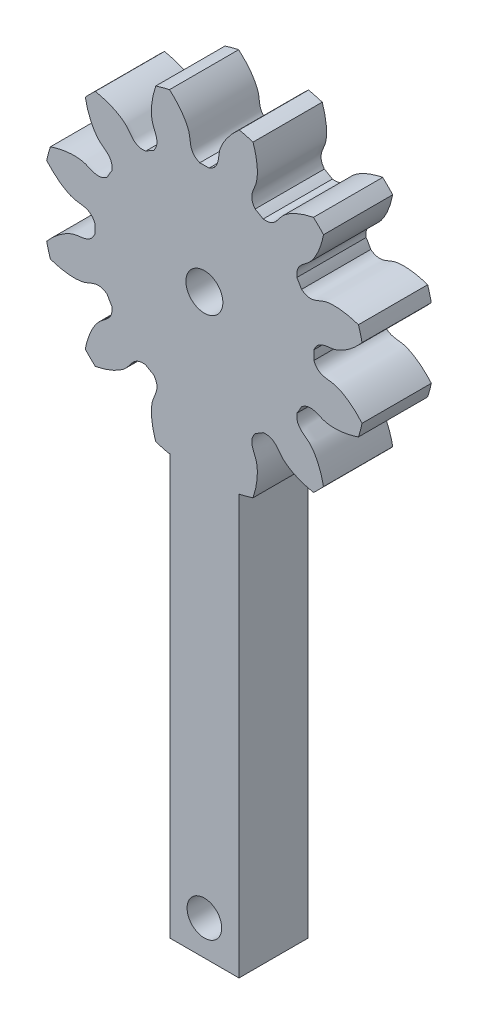
from build123d import *

# Parameters (mm, degrees)
SKETCH_1_R               = 14
EXTRUDE_1_DEPTH          = 30
CUT_EXTRUDE_1_DEPTH      = 36.944401511
PATTERN_CIRCULAR_1_COUNT = 12
CUT_EXTRUDE_START        = -24
CUT_EXTRUDE_2_DEPTH      = 24
EXTRUDE_2_DEPTH          = 6
SKETCH_6_R               = 1.6
CUT_EXTRUDE_3_DEPTH      = 6
SKETCH_7_R               = 1.5
CUT_EXTRUDE_4_DEPTH      = 6


with BuildPart() as part:
    # 草图1 → 凸台-拉伸1 (new body)
    with BuildSketch(Plane.XY):
        Circle(SKETCH_1_R)
    extrude(amount=EXTRUDE_1_DEPTH)

    # 草图2 → 切除-拉伸1 (cut, through all)
    with BuildSketch(Plane.XY):
        with BuildLine():
            ThreePointArc((0.401680225, 9.491504254), (0, 9.5), (-0.401680225, 9.491504254))
            add(Edge.make_bspline(
                [(-0.401680225, 9.491504254), (-1.361577738, 9.898614926), (-1.148746958, 10.689637365), (-1.352304376, 11.378961155), (-1.365247708, 11.419811475), (-1.380454501, 11.46466685), (-1.398085738, 11.513452175), (-1.41830525, 11.566086477), (-1.441273032, 11.622484138), (-1.467147122, 11.682554592), (-1.496082862, 11.746202504), (-1.528232954, 11.813327799), (-1.563747275, 11.883825742), (-1.602772771, 11.957587012), (-1.645453327, 12.034497774), (-1.691929648, 12.114439762), (-1.742339142, 12.197290357), (-1.796815797, 12.282922678), (-1.855490069, 12.371205667), (-1.918488769, 12.462004178), (-1.985934952, 12.555179076), (-2.057947808, 12.650587329), (-2.134642556, 12.748082111), (-2.216130341, 12.847512903), (-2.302518131, 12.948725598), (-2.39390862, 13.051562605), (-2.490400133, 13.155862967), (-2.59208653, 13.261462464), (-2.699057115, 13.368193734), (-2.811396554, 13.475886387), (-2.929184784, 13.584367126), (-3.052496933, 13.693459866), (-3.181403243, 13.802985862), (-3.31596899, 13.912763828), (-3.456254416, 14.02261007), (-3.602314655, 14.132338614), (-3.754199671, 14.241761336), (-3.911954189, 14.350688096), (-4.07561764, 14.458926871), (-4.2452241, 14.566283893), (-4.420802241, 14.672563788), (-4.602375278, 14.77756971), (-4.789960922, 14.881103487), (-4.983571339, 14.98296576), (-5.183213107, 15.082956125), (-5.388887185, 15.18087328), (-5.600588875, 15.276515169), (-5.818307792, 15.369679124), (-6.042027853, 15.460162018), (-6.27172721, 15.547760413), (-6.588759411, 15.661455917), (-6.8311872, 15.740202816), (-6.995210805, 15.78994182)],
                knots=[0, 0, 0, 0, 0.218015236, 0.222043642, 0.226545979, 0.231522246, 0.236972443, 0.24289657, 0.249294627, 0.256166614, 0.263512532, 0.271332379, 0.279626157, 0.288393865, 0.297635503, 0.307351072, 0.31754057, 0.328203999, 0.339341357, 0.350952646, 0.363037866, 0.375597015, 0.388630094, 0.402137104, 0.416118043, 0.430572913, 0.445501713, 0.460904444, 0.476781104, 0.493131694, 0.509956215, 0.527254666, 0.545027047, 0.563273358, 0.581993599, 0.601187771, 0.620855872, 0.640997904, 0.661613866, 0.682703758, 0.704267581, 0.726305333, 0.748817015, 0.771802628, 0.795262171, 0.819195644, 0.843603047, 0.868484381, 0.893839644, 0.919668838, 0.945971962, 1, 1, 1, 1], degree=3))
            ThreePointArc((-6.995210805, 15.78994182), (0, 17.270067658), (6.995210805, 15.78994182))
            add(Edge.make_bspline(
                [(0.401680225, 9.491504254), (1.361577738, 9.898614926), (1.148746958, 10.689637365), (1.352304376, 11.378961155), (1.365247708, 11.419811475), (1.380454501, 11.46466685), (1.398085738, 11.513452175), (1.41830525, 11.566086477), (1.441273032, 11.622484138), (1.467147122, 11.682554592), (1.496082862, 11.746202504), (1.528232954, 11.813327799), (1.563747275, 11.883825742), (1.602772771, 11.957587012), (1.645453327, 12.034497774), (1.691929648, 12.114439762), (1.742339142, 12.197290357), (1.796815797, 12.282922678), (1.855490069, 12.371205667), (1.918488769, 12.462004178), (1.985934952, 12.555179076), (2.057947808, 12.650587329), (2.134642556, 12.748082111), (2.216130341, 12.847512903), (2.302518131, 12.948725598), (2.39390862, 13.051562605), (2.490400133, 13.155862967), (2.59208653, 13.261462464), (2.699057115, 13.368193734), (2.811396554, 13.475886387), (2.929184784, 13.584367126), (3.052496933, 13.693459866), (3.181403243, 13.802985862), (3.31596899, 13.912763828), (3.456254416, 14.02261007), (3.602314655, 14.132338614), (3.754199671, 14.241761336), (3.911954189, 14.350688096), (4.07561764, 14.458926871), (4.2452241, 14.566283893), (4.420802241, 14.672563788), (4.602375278, 14.77756971), (4.789960922, 14.881103487), (4.983571339, 14.98296576), (5.183213107, 15.082956125), (5.388887185, 15.18087328), (5.600588875, 15.276515169), (5.818307792, 15.369679124), (6.042027853, 15.460162018), (6.27172721, 15.547760413), (6.588759411, 15.661455917), (6.8311872, 15.740202816), (6.995210805, 15.78994182)],
                knots=[0, 0, 0, 0, 0.218015236, 0.222043642, 0.226545979, 0.231522246, 0.236972443, 0.24289657, 0.249294627, 0.256166614, 0.263512532, 0.271332379, 0.279626157, 0.288393865, 0.297635503, 0.307351072, 0.31754057, 0.328203999, 0.339341357, 0.350952646, 0.363037866, 0.375597015, 0.388630094, 0.402137104, 0.416118043, 0.430572913, 0.445501713, 0.460904444, 0.476781104, 0.493131694, 0.509956215, 0.527254666, 0.545027047, 0.563273358, 0.581993599, 0.601187771, 0.620855872, 0.640997904, 0.661613866, 0.682703758, 0.704267581, 0.726305333, 0.748817015, 0.771802628, 0.795262171, 0.819195644, 0.843603047, 0.868484381, 0.893839644, 0.919668838, 0.945971962, 1, 1, 1, 1], degree=3))
        make_face()
    cut_extrude_1 = extrude(amount=CUT_EXTRUDE_1_DEPTH, mode=Mode.SUBTRACT)

    # 阵列(圆周)1: 切除-拉伸1 ×12 about axis
    pattern_circular_1_axis = Axis((0, 0, -0.30005125), (0, 0, 1))
    for i in range(1, PATTERN_CIRCULAR_1_COUNT):
        add(cut_extrude_1.rotate(pattern_circular_1_axis, i * 360 / PATTERN_CIRCULAR_1_COUNT), mode=Mode.SUBTRACT)

    # 草图4 → 切除-拉伸2 (cut)
    with BuildSketch(Plane.XY.offset(30).offset(CUT_EXTRUDE_START)):
        with BuildLine():
            ThreePointArc((-4.397886848, 8.420723916), (-4.75, 8.227241336), (-5.093617406, 8.019043691))
            add(Edge.make_bspline(
                [(-5.093617406, 8.019043691), (-6.128468373, 7.891663119), (-6.33966273, 8.683124036), (-6.872053563, 9.189194563), (-6.930941729, 9.241779272), (-7.014505355, 9.310630069), (-7.115111456, 9.387017791), (-7.23347479, 9.469670849), (-7.370233356, 9.557275088), (-7.525948259, 9.64847587), (-7.701100996, 9.741882669), (-7.896091644, 9.836073182), (-8.111237094, 9.929597664), (-8.346769551, 10.020983326), (-8.602835229, 10.108738806), (-8.879493287, 10.191358711), (-9.165466077, 10.264453), (-9.359907912, 10.306399947), (-9.454720416, 10.325127692)],
                knots=[0.476404433, 0.476404433, 0.476404433, 0.476404433, 0.694419669, 0.698448075, 0.707926679, 0.719301003, 0.732571047, 0.747736812, 0.764798298, 0.783755505, 0.804608432, 0.827357079, 0.852001448, 0.878541537, 0.906977346, 0.937308876, 0.969536127, 1, 1, 1, 1], degree=3))
            ThreePointArc((-9.454720416, 10.325127692), (-9.899494937, 9.899494937), (-10.325127692, 9.454720416))
            add(Edge.make_bspline(
                [(-10.325127692, 9.454720416), (-10.296348379, 9.30902008), (-10.241822597, 9.06724705), (-10.150785285, 8.738589846), (-10.065408695, 8.472229927), (-9.975650733, 8.226443701), (-9.883010304, 8.001128416), (-9.788970056, 7.796094703), (-9.694991809, 7.61106784), (-9.602512134, 7.445689138), (-9.512937986, 7.299517571), (-9.427642444, 7.172031609), (-9.359027476, 7.077825756), (-9.296764283, 6.997676569), (-9.241778736, 6.930942283), (-9.189194563, 6.872053563), (-8.683124036, 6.33966273), (-7.891663119, 6.128468373), (-8.019043691, 5.093617406)],
                knots=[0, 0, 0, 0, 0.046814463, 0.078093854, 0.107477524, 0.134965473, 0.160557702, 0.18425421, 0.206054997, 0.225960064, 0.24396941, 0.260083035, 0.27430094, 0.280698997, 0.292073321, 0.301551925, 0.305580331, 0.523595567, 0.523595567, 0.523595567, 0.523595567], degree=3))
            ThreePointArc((-8.019043691, 5.093617406), (-8.227241336, 4.75), (-8.420723916, 4.397886848))
            add(Edge.make_bspline(
                [(-8.420723916, 4.397886848), (-9.253240857, 3.770146552), (-9.831870994, 4.349974635), (-10.545970243, 4.52204915), (-10.623261245, 4.538144761), (-10.730054867, 4.555989488), (-10.855376167, 4.571840145), (-10.99920835, 4.584238126), (-11.161446862, 4.59172634), (-11.341900315, 4.592851082), (-11.540290435, 4.586167374), (-11.756252545, 4.570243427), (-11.989336212, 4.543665279), (-12.239006133, 4.505041355), (-12.504643256, 4.453006992), (-12.785546114, 4.386228899), (-13.06975296, 4.306544015), (-13.259118002, 4.24565022), (-13.350591912, 4.214462671)],
                knots=[0.476404433, 0.476404433, 0.476404433, 0.476404433, 0.694419669, 0.698448075, 0.707926679, 0.719301003, 0.732571047, 0.747736812, 0.764798298, 0.783755505, 0.804608432, 0.827357079, 0.852001448, 0.878541537, 0.906977346, 0.937308876, 0.969536127, 1, 1, 1, 1], degree=3))
            ThreePointArc((-13.350591912, 4.214462671), (-13.522961568, 3.623466631), (-13.669183087, 3.02546422))
            add(Edge.make_bspline(
                [(-13.669183087, 3.02546422), (-13.571409302, 2.913673684), (-13.403302075, 2.731554989), (-13.160132848, 2.492448157), (-12.953014593, 2.304461996), (-12.752388805, 2.136483862), (-12.559502197, 1.987675315), (-12.375544097, 1.857131035), (-12.201643116, 1.743882195), (-12.038864017, 1.646899875), (-11.888204746, 1.565098659), (-11.750593659, 1.497340348), (-11.644068427, 1.45006317), (-11.550072327, 1.411783535), (-11.469086303, 1.381482721), (-11.394102713, 1.35677568), (-10.689637365, 1.148746958), (-9.898614926, 1.361577738), (-9.491504254, 0.401680225)],
                knots=[0, 0, 0, 0, 0.046814463, 0.078093854, 0.107477524, 0.134965473, 0.160557702, 0.18425421, 0.206054997, 0.225960064, 0.24396941, 0.260083035, 0.27430094, 0.280698997, 0.292073321, 0.301551925, 0.305580331, 0.523595567, 0.523595567, 0.523595567, 0.523595567], degree=3))
            ThreePointArc((-9.491504254, 0.401680225), (-9.5, 0), (-9.491504254, -0.401680225))
            add(Edge.make_bspline(
                [(-9.491504254, -0.401680225), (-9.898614926, -1.361577738), (-10.689637365, -1.148746958), (-11.394102713, -1.35677568), (-11.46908649, -1.381481974), (-11.570494842, -1.419424798), (-11.686951601, -1.468358376), (-11.817712915, -1.529537501), (-11.961959695, -1.604171774), (-12.118799341, -1.693424445), (-12.287268371, -1.798407765), (-12.466335071, -1.920179363), (-12.654902373, -2.059738548), (-12.851810906, -2.218022808), (-13.055842221, -2.39590445), (-13.265722186, -2.594187404), (-13.472010092, -2.805299961), (-13.605558131, -2.952718055), (-13.669183087, -3.02546422)],
                knots=[0.476404433, 0.476404433, 0.476404433, 0.476404433, 0.694419669, 0.698448075, 0.707926679, 0.719301003, 0.732571047, 0.747736812, 0.764798298, 0.783755505, 0.804608432, 0.827357079, 0.852001448, 0.878541537, 0.906977346, 0.937308876, 0.969536127, 1, 1, 1, 1], degree=3))
            ThreePointArc((-13.669183087, -3.02546422), (-13.522961568, -3.623466631), (-13.350591912, -4.214462671))
            add(Edge.make_bspline(
                [(-13.350591912, -4.214462671), (-13.210022063, -4.262389222), (-12.973377586, -4.336055025), (-12.643233442, -4.421543002), (-12.369870692, -4.480784666), (-12.112134595, -4.525945103), (-11.870685619, -4.558373781), (-11.646101091, -4.579449393), (-11.438874004, -4.590575276), (-11.249412009, -4.593174879), (-11.078036645, -4.588687175), (-10.924982792, -4.57856205), (-10.809090647, -4.566242671), (-10.708547818, -4.552395758), (-10.623261457, -4.53814402), (-10.545970243, -4.52204915), (-9.831870994, -4.349974635), (-9.253240857, -3.770146552), (-8.420723916, -4.397886848)],
                knots=[0, 0, 0, 0, 0.046814463, 0.078093854, 0.107477524, 0.134965473, 0.160557702, 0.18425421, 0.206054997, 0.225960064, 0.24396941, 0.260083035, 0.27430094, 0.280698997, 0.292073321, 0.301551925, 0.305580331, 0.523595567, 0.523595567, 0.523595567, 0.523595567], degree=3))
            ThreePointArc((-8.420723916, -4.397886848), (-8.227241336, -4.75), (-8.019043691, -5.093617406))
            add(Edge.make_bspline(
                [(-8.019043691, -5.093617406), (-7.891663119, -6.128468373), (-8.683124036, -6.33966273), (-9.189194563, -6.872053563), (-9.241779272, -6.930941729), (-9.310630069, -7.014505355), (-9.387017791, -7.115111456), (-9.469670849, -7.23347479), (-9.557275088, -7.370233356), (-9.64847587, -7.525948259), (-9.741882669, -7.701100996), (-9.836073182, -7.896091644), (-9.929597664, -8.111237094), (-10.020983326, -8.346769551), (-10.108738806, -8.602835229), (-10.191358711, -8.879493287), (-10.264453, -9.165466077), (-10.306399947, -9.359907912), (-10.325127692, -9.454720416)],
                knots=[0.476404433, 0.476404433, 0.476404433, 0.476404433, 0.694419669, 0.698448075, 0.707926679, 0.719301003, 0.732571047, 0.747736812, 0.764798298, 0.783755505, 0.804608432, 0.827357079, 0.852001448, 0.878541537, 0.906977346, 0.937308876, 0.969536127, 1, 1, 1, 1], degree=3))
            ThreePointArc((-10.325127692, -9.454720416), (-9.899494937, -9.899494937), (-9.454720416, -10.325127692))
            add(Edge.make_bspline(
                [(-9.454720416, -10.325127692), (-9.30902008, -10.296348379), (-9.06724705, -10.241822597), (-8.738589846, -10.150785285), (-8.472229927, -10.065408695), (-8.226443701, -9.975650733), (-8.001128416, -9.883010304), (-7.796094703, -9.788970056), (-7.61106784, -9.694991809), (-7.445689138, -9.602512134), (-7.299517571, -9.512937986), (-7.172031609, -9.427642444), (-7.077825756, -9.359027476), (-6.997676569, -9.296764283), (-6.930942283, -9.241778736), (-6.872053563, -9.189194563), (-6.33966273, -8.683124036), (-6.128468373, -7.891663119), (-5.093617406, -8.019043691)],
                knots=[0, 0, 0, 0, 0.046814463, 0.078093854, 0.107477524, 0.134965473, 0.160557702, 0.18425421, 0.206054997, 0.225960064, 0.24396941, 0.260083035, 0.27430094, 0.280698997, 0.292073321, 0.301551925, 0.305580331, 0.523595567, 0.523595567, 0.523595567, 0.523595567], degree=3))
            ThreePointArc((-5.093617406, -8.019043691), (-4.75, -8.227241336), (-4.397886848, -8.420723916))
            add(Edge.make_bspline(
                [(-4.397886848, -8.420723916), (-3.770146552, -9.253240857), (-4.349974635, -9.831870994), (-4.52204915, -10.545970243), (-4.538144761, -10.623261245), (-4.555989488, -10.730054867), (-4.571840145, -10.855376167), (-4.584238126, -10.99920835), (-4.59172634, -11.161446862), (-4.592851082, -11.341900315), (-4.586167374, -11.540290435), (-4.570243427, -11.756252545), (-4.543665279, -11.989336212), (-4.505041355, -12.239006133), (-4.453006992, -12.504643256), (-4.386228899, -12.785546114), (-4.306544015, -13.06975296), (-4.24565022, -13.259118002), (-4.214462671, -13.350591912)],
                knots=[0.476404433, 0.476404433, 0.476404433, 0.476404433, 0.694419669, 0.698448075, 0.707926679, 0.719301003, 0.732571047, 0.747736812, 0.764798298, 0.783755505, 0.804608432, 0.827357079, 0.852001448, 0.878541537, 0.906977346, 0.937308876, 0.969536127, 1, 1, 1, 1], degree=3))
            ThreePointArc((-4.214462671, -13.350591912), (-3.623466631, -13.522961568), (-3.02546422, -13.669183087))
            add(Edge.make_bspline(
                [(-3.02546422, -13.669183087), (-2.913673684, -13.571409302), (-2.731554989, -13.403302075), (-2.492448157, -13.160132848), (-2.304461996, -12.953014593), (-2.136483862, -12.752388805), (-1.987675315, -12.559502197), (-1.857131035, -12.375544097), (-1.743882195, -12.201643116), (-1.646899875, -12.038864017), (-1.565098659, -11.888204746), (-1.497340348, -11.750593659), (-1.45006317, -11.644068427), (-1.411783535, -11.550072327), (-1.381482721, -11.469086303), (-1.35677568, -11.394102713), (-1.148746958, -10.689637365), (-1.361577738, -9.898614926), (-0.401680225, -9.491504254)],
                knots=[0, 0, 0, 0, 0.046814463, 0.078093854, 0.107477524, 0.134965473, 0.160557702, 0.18425421, 0.206054997, 0.225960064, 0.24396941, 0.260083035, 0.27430094, 0.280698997, 0.292073321, 0.301551925, 0.305580331, 0.523595567, 0.523595567, 0.523595567, 0.523595567], degree=3))
            ThreePointArc((-0.401680225, -9.491504254), (0, -9.5), (0.401680225, -9.491504254))
            add(Edge.make_bspline(
                [(0.401680225, -9.491504254), (1.361577738, -9.898614926), (1.148746958, -10.689637365), (1.35677568, -11.394102713), (1.381481974, -11.46908649), (1.419424798, -11.570494842), (1.468358376, -11.686951601), (1.529537501, -11.817712915), (1.604171774, -11.961959695), (1.693424445, -12.118799341), (1.798407765, -12.287268371), (1.920179363, -12.466335071), (2.059738548, -12.654902373), (2.218022808, -12.851810906), (2.39590445, -13.055842221), (2.594187404, -13.265722186), (2.805299961, -13.472010092), (2.952718055, -13.605558131), (3.02546422, -13.669183087)],
                knots=[0.476404433, 0.476404433, 0.476404433, 0.476404433, 0.694419669, 0.698448075, 0.707926679, 0.719301003, 0.732571047, 0.747736812, 0.764798298, 0.783755505, 0.804608432, 0.827357079, 0.852001448, 0.878541537, 0.906977346, 0.937308876, 0.969536127, 1, 1, 1, 1], degree=3))
            ThreePointArc((3.02546422, -13.669183087), (3.623466631, -13.522961568), (4.214462671, -13.350591912))
            add(Edge.make_bspline(
                [(4.214462671, -13.350591912), (4.262389222, -13.210022063), (4.336055025, -12.973377586), (4.421543002, -12.643233442), (4.480784666, -12.369870692), (4.525945103, -12.112134595), (4.558373781, -11.870685619), (4.579449393, -11.646101091), (4.590575276, -11.438874004), (4.593174879, -11.249412009), (4.588687175, -11.078036645), (4.57856205, -10.924982792), (4.566242671, -10.809090647), (4.552395758, -10.708547818), (4.53814402, -10.623261457), (4.52204915, -10.545970243), (4.349974635, -9.831870994), (3.770146552, -9.253240857), (4.397886848, -8.420723916)],
                knots=[0, 0, 0, 0, 0.046814463, 0.078093854, 0.107477524, 0.134965473, 0.160557702, 0.18425421, 0.206054997, 0.225960064, 0.24396941, 0.260083035, 0.27430094, 0.280698997, 0.292073321, 0.301551925, 0.305580331, 0.523595567, 0.523595567, 0.523595567, 0.523595567], degree=3))
            ThreePointArc((4.397886848, -8.420723916), (4.75, -8.227241336), (5.093617406, -8.019043691))
            add(Edge.make_bspline(
                [(5.093617406, -8.019043691), (6.128468373, -7.891663119), (6.33966273, -8.683124036), (6.872053563, -9.189194563), (6.930941729, -9.241779272), (7.014505355, -9.310630069), (7.115111456, -9.387017791), (7.23347479, -9.469670849), (7.370233356, -9.557275088), (7.525948259, -9.64847587), (7.701100996, -9.741882669), (7.896091644, -9.836073182), (8.111237094, -9.929597664), (8.346769551, -10.020983326), (8.602835229, -10.108738806), (8.879493287, -10.191358711), (9.165466077, -10.264453), (9.359907912, -10.306399947), (9.454720416, -10.325127692)],
                knots=[0.476404433, 0.476404433, 0.476404433, 0.476404433, 0.694419669, 0.698448075, 0.707926679, 0.719301003, 0.732571047, 0.747736812, 0.764798298, 0.783755505, 0.804608432, 0.827357079, 0.852001448, 0.878541537, 0.906977346, 0.937308876, 0.969536127, 1, 1, 1, 1], degree=3))
            ThreePointArc((9.454720416, -10.325127692), (9.899494937, -9.899494937), (10.325127692, -9.454720416))
            add(Edge.make_bspline(
                [(10.325127692, -9.454720416), (10.296348379, -9.30902008), (10.241822597, -9.06724705), (10.150785285, -8.738589846), (10.065408695, -8.472229927), (9.975650733, -8.226443701), (9.883010304, -8.001128416), (9.788970056, -7.796094703), (9.694991809, -7.61106784), (9.602512134, -7.445689138), (9.512937986, -7.299517571), (9.427642444, -7.172031609), (9.359027476, -7.077825756), (9.296764283, -6.997676569), (9.241778736, -6.930942283), (9.189194563, -6.872053563), (8.683124036, -6.33966273), (7.891663119, -6.128468373), (8.019043691, -5.093617406)],
                knots=[0, 0, 0, 0, 0.046814463, 0.078093854, 0.107477524, 0.134965473, 0.160557702, 0.18425421, 0.206054997, 0.225960064, 0.24396941, 0.260083035, 0.27430094, 0.280698997, 0.292073321, 0.301551925, 0.305580331, 0.523595567, 0.523595567, 0.523595567, 0.523595567], degree=3))
            ThreePointArc((8.019043691, -5.093617406), (8.227241336, -4.75), (8.420723916, -4.397886848))
            add(Edge.make_bspline(
                [(8.420723916, -4.397886848), (9.253240857, -3.770146552), (9.831870994, -4.349974635), (10.545970243, -4.52204915), (10.623261245, -4.538144761), (10.730054867, -4.555989488), (10.855376167, -4.571840145), (10.99920835, -4.584238126), (11.161446862, -4.59172634), (11.341900315, -4.592851082), (11.540290435, -4.586167374), (11.756252545, -4.570243427), (11.989336212, -4.543665279), (12.239006133, -4.505041355), (12.504643256, -4.453006992), (12.785546114, -4.386228899), (13.06975296, -4.306544015), (13.259118002, -4.24565022), (13.350591912, -4.214462671)],
                knots=[0.476404433, 0.476404433, 0.476404433, 0.476404433, 0.694419669, 0.698448075, 0.707926679, 0.719301003, 0.732571047, 0.747736812, 0.764798298, 0.783755505, 0.804608432, 0.827357079, 0.852001448, 0.878541537, 0.906977346, 0.937308876, 0.969536127, 1, 1, 1, 1], degree=3))
            ThreePointArc((13.350591912, -4.214462671), (13.522961568, -3.623466631), (13.669183087, -3.02546422))
            add(Edge.make_bspline(
                [(13.669183087, -3.02546422), (13.571409302, -2.913673684), (13.403302075, -2.731554989), (13.160132848, -2.492448157), (12.953014593, -2.304461996), (12.752388805, -2.136483862), (12.559502197, -1.987675315), (12.375544097, -1.857131035), (12.201643116, -1.743882195), (12.038864017, -1.646899875), (11.888204746, -1.565098659), (11.750593659, -1.497340348), (11.644068427, -1.45006317), (11.550072327, -1.411783535), (11.469086303, -1.381482721), (11.394102713, -1.35677568), (10.689637365, -1.148746958), (9.898614926, -1.361577738), (9.491504254, -0.401680225)],
                knots=[0, 0, 0, 0, 0.046814463, 0.078093854, 0.107477524, 0.134965473, 0.160557702, 0.18425421, 0.206054997, 0.225960064, 0.24396941, 0.260083035, 0.27430094, 0.280698997, 0.292073321, 0.301551925, 0.305580331, 0.523595567, 0.523595567, 0.523595567, 0.523595567], degree=3))
            ThreePointArc((9.491504254, -0.401680225), (9.5, 0), (9.491504254, 0.401680225))
            add(Edge.make_bspline(
                [(9.491504254, 0.401680225), (9.898614926, 1.361577738), (10.689637365, 1.148746958), (11.394102713, 1.35677568), (11.46908649, 1.381481974), (11.570494842, 1.419424798), (11.686951601, 1.468358376), (11.817712915, 1.529537501), (11.961959695, 1.604171774), (12.118799341, 1.693424445), (12.287268371, 1.798407765), (12.466335071, 1.920179363), (12.654902373, 2.059738548), (12.851810906, 2.218022808), (13.055842221, 2.39590445), (13.265722186, 2.594187404), (13.472010092, 2.805299961), (13.605558131, 2.952718055), (13.669183087, 3.02546422)],
                knots=[0.476404433, 0.476404433, 0.476404433, 0.476404433, 0.694419669, 0.698448075, 0.707926679, 0.719301003, 0.732571047, 0.747736812, 0.764798298, 0.783755505, 0.804608432, 0.827357079, 0.852001448, 0.878541537, 0.906977346, 0.937308876, 0.969536127, 1, 1, 1, 1], degree=3))
            ThreePointArc((13.669183087, 3.02546422), (13.522961568, 3.623466631), (13.350591912, 4.214462671))
            add(Edge.make_bspline(
                [(13.350591912, 4.214462671), (13.210022063, 4.262389222), (12.973377586, 4.336055025), (12.643233442, 4.421543002), (12.369870692, 4.480784666), (12.112134595, 4.525945103), (11.870685619, 4.558373781), (11.646101091, 4.579449393), (11.438874004, 4.590575276), (11.249412009, 4.593174879), (11.078036645, 4.588687175), (10.924982792, 4.57856205), (10.809090647, 4.566242671), (10.708547818, 4.552395758), (10.623261457, 4.53814402), (10.545970243, 4.52204915), (9.831870994, 4.349974635), (9.253240857, 3.770146552), (8.420723916, 4.397886848)],
                knots=[0, 0, 0, 0, 0.046814463, 0.078093854, 0.107477524, 0.134965473, 0.160557702, 0.18425421, 0.206054997, 0.225960064, 0.24396941, 0.260083035, 0.27430094, 0.280698997, 0.292073321, 0.301551925, 0.305580331, 0.523595567, 0.523595567, 0.523595567, 0.523595567], degree=3))
            ThreePointArc((8.420723916, 4.397886848), (8.227241336, 4.75), (8.019043691, 5.093617406))
            add(Edge.make_bspline(
                [(8.019043691, 5.093617406), (7.891663119, 6.128468373), (8.683124036, 6.33966273), (9.189194563, 6.872053563), (9.241779272, 6.930941729), (9.310630069, 7.014505355), (9.387017791, 7.115111456), (9.469670849, 7.23347479), (9.557275088, 7.370233356), (9.64847587, 7.525948259), (9.741882669, 7.701100996), (9.836073182, 7.896091644), (9.929597664, 8.111237094), (10.020983326, 8.346769551), (10.108738806, 8.602835229), (10.191358711, 8.879493287), (10.264453, 9.165466077), (10.306399947, 9.359907912), (10.325127692, 9.454720416)],
                knots=[0.476404433, 0.476404433, 0.476404433, 0.476404433, 0.694419669, 0.698448075, 0.707926679, 0.719301003, 0.732571047, 0.747736812, 0.764798298, 0.783755505, 0.804608432, 0.827357079, 0.852001448, 0.878541537, 0.906977346, 0.937308876, 0.969536127, 1, 1, 1, 1], degree=3))
            ThreePointArc((10.325127692, 9.454720416), (9.899494937, 9.899494937), (9.454720416, 10.325127692))
            add(Edge.make_bspline(
                [(9.454720416, 10.325127692), (9.30902008, 10.296348379), (9.06724705, 10.241822597), (8.738589846, 10.150785285), (8.472229927, 10.065408695), (8.226443701, 9.975650733), (8.001128416, 9.883010304), (7.796094703, 9.788970056), (7.61106784, 9.694991809), (7.445689138, 9.602512134), (7.299517571, 9.512937986), (7.172031609, 9.427642444), (7.077825756, 9.359027476), (6.997676569, 9.296764283), (6.930942283, 9.241778736), (6.872053563, 9.189194563), (6.33966273, 8.683124036), (6.128468373, 7.891663119), (5.093617406, 8.019043691)],
                knots=[0, 0, 0, 0, 0.046814463, 0.078093854, 0.107477524, 0.134965473, 0.160557702, 0.18425421, 0.206054997, 0.225960064, 0.24396941, 0.260083035, 0.27430094, 0.280698997, 0.292073321, 0.301551925, 0.305580331, 0.523595567, 0.523595567, 0.523595567, 0.523595567], degree=3))
            ThreePointArc((5.093617406, 8.019043691), (4.75, 8.227241336), (4.397886848, 8.420723916))
            add(Edge.make_bspline(
                [(4.397886848, 8.420723916), (3.770146552, 9.253240857), (4.349974635, 9.831870994), (4.52204915, 10.545970243), (4.538144761, 10.623261245), (4.555989488, 10.730054867), (4.571840145, 10.855376167), (4.584238126, 10.99920835), (4.59172634, 11.161446862), (4.592851082, 11.341900315), (4.586167374, 11.540290435), (4.570243427, 11.756252545), (4.543665279, 11.989336212), (4.505041355, 12.239006133), (4.453006992, 12.504643256), (4.386228899, 12.785546114), (4.306544015, 13.06975296), (4.24565022, 13.259118002), (4.214462671, 13.350591912)],
                knots=[0.476404433, 0.476404433, 0.476404433, 0.476404433, 0.694419669, 0.698448075, 0.707926679, 0.719301003, 0.732571047, 0.747736812, 0.764798298, 0.783755505, 0.804608432, 0.827357079, 0.852001448, 0.878541537, 0.906977346, 0.937308876, 0.969536127, 1, 1, 1, 1], degree=3))
            ThreePointArc((4.214462671, 13.350591912), (3.623466631, 13.522961568), (3.02546422, 13.669183087))
            add(Edge.make_bspline(
                [(3.02546422, 13.669183087), (2.913673684, 13.571409302), (2.731554989, 13.403302075), (2.492448157, 13.160132848), (2.304461996, 12.953014593), (2.136483862, 12.752388805), (1.987675315, 12.559502197), (1.857131035, 12.375544097), (1.743882195, 12.201643116), (1.646899875, 12.038864017), (1.565098659, 11.888204746), (1.497340348, 11.750593659), (1.45006317, 11.644068427), (1.411783535, 11.550072327), (1.381482721, 11.469086303), (1.35677568, 11.394102713), (1.148746958, 10.689637365), (1.361577738, 9.898614926), (0.401680225, 9.491504254)],
                knots=[0, 0, 0, 0, 0.046814463, 0.078093854, 0.107477524, 0.134965473, 0.160557702, 0.18425421, 0.206054997, 0.225960064, 0.24396941, 0.260083035, 0.27430094, 0.280698997, 0.292073321, 0.301551925, 0.305580331, 0.523595567, 0.523595567, 0.523595567, 0.523595567], degree=3))
            ThreePointArc((0.401680225, 9.491504254), (0, 9.5), (-0.401680225, 9.491504254))
            add(Edge.make_bspline(
                [(-0.401680225, 9.491504254), (-1.361577738, 9.898614926), (-1.148746958, 10.689637365), (-1.35677568, 11.394102713), (-1.381481974, 11.46908649), (-1.419424798, 11.570494842), (-1.468358376, 11.686951601), (-1.529537501, 11.817712915), (-1.604171774, 11.961959695), (-1.693424445, 12.118799341), (-1.798407765, 12.287268371), (-1.920179363, 12.466335071), (-2.059738548, 12.654902373), (-2.218022808, 12.851810906), (-2.39590445, 13.055842221), (-2.594187404, 13.265722186), (-2.805299961, 13.472010092), (-2.952718055, 13.605558131), (-3.02546422, 13.669183087)],
                knots=[0.476404433, 0.476404433, 0.476404433, 0.476404433, 0.694419669, 0.698448075, 0.707926679, 0.719301003, 0.732571047, 0.747736812, 0.764798298, 0.783755505, 0.804608432, 0.827357079, 0.852001448, 0.878541537, 0.906977346, 0.937308876, 0.969536127, 1, 1, 1, 1], degree=3))
            ThreePointArc((-3.02546422, 13.669183087), (-3.623466631, 13.522961568), (-4.214462671, 13.350591912))
            add(Edge.make_bspline(
                [(-4.214462671, 13.350591912), (-4.262389222, 13.210022063), (-4.336055025, 12.973377586), (-4.421543002, 12.643233442), (-4.480784666, 12.369870692), (-4.525945103, 12.112134595), (-4.558373781, 11.870685619), (-4.579449393, 11.646101091), (-4.590575276, 11.438874004), (-4.593174879, 11.249412009), (-4.588687175, 11.078036645), (-4.57856205, 10.924982792), (-4.566242671, 10.809090647), (-4.552395758, 10.708547818), (-4.53814402, 10.623261457), (-4.52204915, 10.545970243), (-4.349974635, 9.831870994), (-3.770146552, 9.253240857), (-4.397886848, 8.420723916)],
                knots=[0, 0, 0, 0, 0.046814463, 0.078093854, 0.107477524, 0.134965473, 0.160557702, 0.18425421, 0.206054997, 0.225960064, 0.24396941, 0.260083035, 0.27430094, 0.280698997, 0.292073321, 0.301551925, 0.305580331, 0.523595567, 0.523595567, 0.523595567, 0.523595567], degree=3))
        make_face()
    extrude(amount=CUT_EXTRUDE_2_DEPTH, mode=Mode.SUBTRACT)

    # 草图5 → 凸台-拉伸2 (add)
    with BuildSketch(Plane.XY.offset(6)):
        Polygon((0, -5), (-3, -5), (-3, -50), (3, -50), (3, -5), align=None)
    extrude(amount=-EXTRUDE_2_DEPTH)

    # 草图6 → 切除-拉伸3 (cut)
    with BuildSketch(Plane.XY.offset(6)):
        Circle(SKETCH_6_R)
    extrude(amount=-CUT_EXTRUDE_3_DEPTH, mode=Mode.SUBTRACT)

    # 草图7 → 切除-拉伸4 (cut)
    with BuildSketch(Plane.XY.offset(6)):
        with Locations((0, -47)):
            Circle(SKETCH_7_R)
    extrude(amount=-CUT_EXTRUDE_4_DEPTH, mode=Mode.SUBTRACT)


solid = part.part
